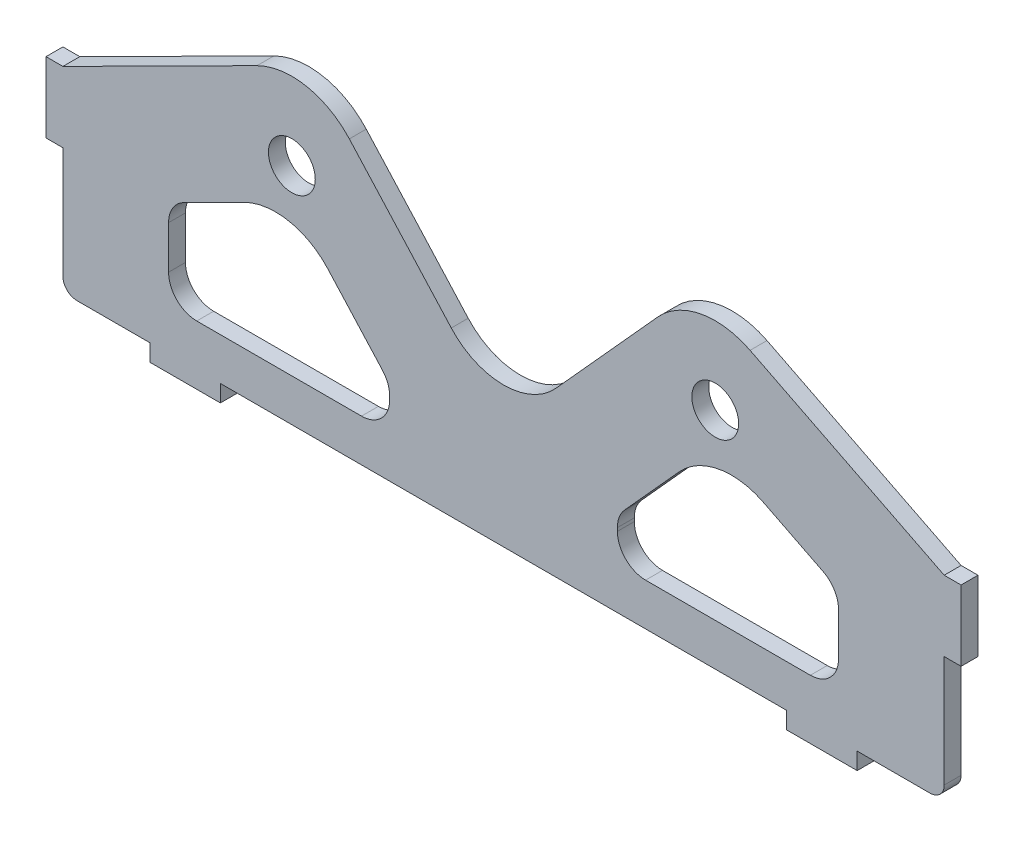
from build123d import *

# Parameters (mm, degrees)
SKETCH1_R            = 4.22275
BOSS_EXTRUDE1_DEPTH  = 3.048
FILLET1_R            = 12.7
CUT_EXTRUDE1_DEPTH   = 99.865112417
FILLET2_R            = 5.08
FILLET2_OF_MIRROR1_R = 5.08


with BuildPart() as part:
    # Sketch1 → Boss-Extrude1 (new body)
    with BuildSketch(Plane.XY):
        with BuildLine():
            Line((-51.054, 0), (51.054, 0))
            Line((51.054, 0), (51.054, -3.048))
            Line((51.054, -3.048), (63.754, -3.048))
            Line((63.754, -3.048), (63.754, 0))
            Line((63.754, 0), (76.901088515, 0))
            ThreePointArc((76.901088515, 0), (78.697139739, 0.743948776), (79.441088515, 2.54))
            Line((79.441088515, 2.54), (79.441088515, 22.606))
            Line((79.441088515, 22.606), (82.489088515, 22.606))
            Line((82.489088515, 22.606), (82.489088515, 35.306))
            Line((82.489088515, 35.306), (79.441088515, 35.306))
            Line((79.441088515, 35.306), (44.446875311, 52.919610269))
            ThreePointArc((44.446875311, 52.919610269), (35.59956089, 54.173342996), (27.802298322, 49.808768027))
            Line((27.802298322, 49.808768027), (0, 19.05))
            Line((0, 19.05), (-27.802298322, 49.808768027))
            ThreePointArc((-27.802298322, 49.808768027), (-35.59956089, 54.173342996), (-44.446875311, 52.919610269))
            Line((-44.446875311, 52.919610269), (-79.441088515, 35.306))
            Line((-79.441088515, 35.306), (-82.489088515, 35.306))
            Line((-82.489088515, 35.306), (-82.489088515, 22.606))
            Line((-82.489088515, 22.606), (-79.441088515, 22.606))
            Line((-79.441088515, 22.606), (-79.441088515, 2.54))
            ThreePointArc((-79.441088515, 2.54), (-78.697139739, 0.743948776), (-76.901088515, 0))
            Line((-76.901088515, 0), (-63.754, 0))
            Line((-63.754, 0), (-63.754, -3.048))
            Line((-63.754, -3.048), (-51.054, -3.048))
            Line((-51.054, -3.048), (-51.054, 0))
        make_face()
        with Locations((-38.166088515, 40.441124095)):
            Circle(SKETCH1_R, mode=Mode.SUBTRACT)
        with Locations((38.166088515, 40.441124095)):
            Circle(SKETCH1_R, mode=Mode.SUBTRACT)
    extrude(amount=-BOSS_EXTRUDE1_DEPTH)

    # Fillet1
    fillet1_edges = [part.edges().sort_by_distance(p)[0] for p in [
        (0, 19.05, -1.524),
    ]]
    fillet(fillet1_edges, radius=FILLET1_R)

    # Sketch3 → Cut-Extrude1 (cut, symmetric)
    with BuildSketch(Plane.XY):
        with BuildLine():
            Line((-46.809147234, 30.403623766), (-60.391088515, 23.567435764))
            Line((-60.391088515, 23.567435764), (-60.391088515, 7.62))
            Line((-60.391088515, 7.62), (-20.527799413, 7.62))
            Line((-20.527799413, 7.62), (-20.527799413, 15.24))
            Line((-20.527799413, 15.24), (-31.677713608, 27.575585363))
            ThreePointArc((-31.677713608, 27.575585363), (-38.766134124, 31.54338079), (-46.809147234, 30.403623766))
        make_face()
    cut_extrude1 = extrude(amount=CUT_EXTRUDE1_DEPTH, both=True, mode=Mode.SUBTRACT)

    # Fillet2
    fillet2_edges = [part.edges().sort_by_distance(p)[0] for p in [
        (-60.391088515, 7.62, -1.524),
        (-20.527799413, 7.62, -1.524),
        (-20.527799413, 15.24, -1.524),
        (-60.391088515, 23.567435764, -1.524),
    ]]
    fillet(fillet2_edges, radius=FILLET2_R)

    # Mirror1: Cut-Extrude1 across plane
    add(cut_extrude1.mirror(Plane(origin=(0, 0, 0), x_dir=(0, 0, 1), z_dir=(1, 0, 0))), mode=Mode.SUBTRACT)

    # Fillet2 of Mirror1
    fillet2_of_mirror1_edges = [part.edges().sort_by_distance(p)[0] for p in [
        (60.391088515, 7.62, -1.524),
        (20.527799413, 7.62, -1.524),
        (20.527799413, 15.24, -1.524),
        (60.391088515, 23.567435764, -1.524),
    ]]
    fillet(fillet2_of_mirror1_edges, radius=FILLET2_OF_MIRROR1_R)


solid = part.part
